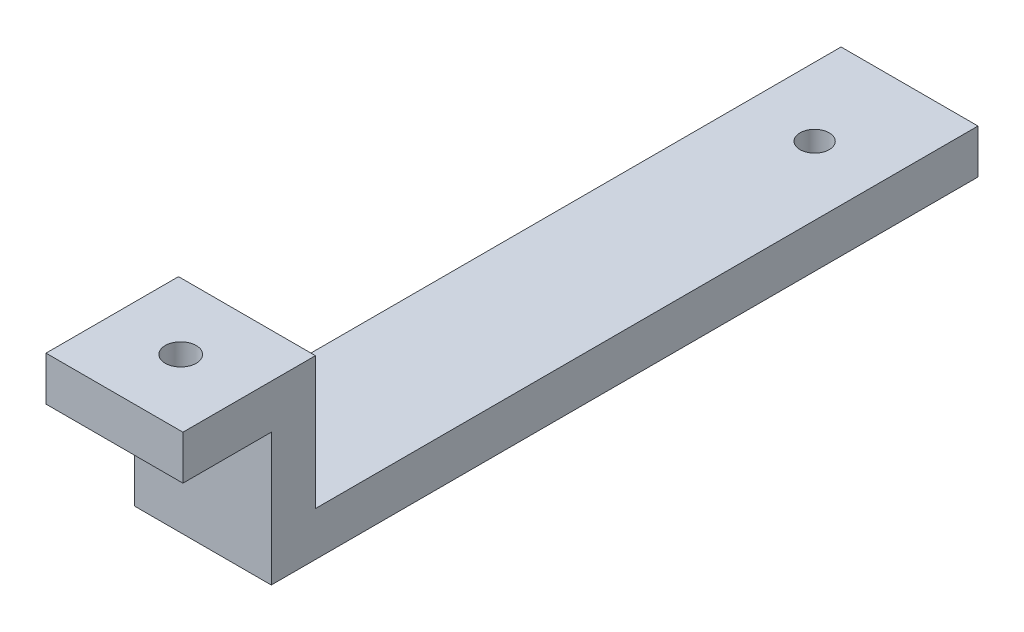
from build123d import *

# Parameters (mm, degrees)
EXTRUDE_THIN1_DEPTH = 31
SKETCH6_R           = 3.5
CUT_EXTRUDE1_DEPTH  = 10
SKETCH7_R           = 3.302
CUT_EXTRUDE3_DEPTH  = 10.16


with BuildPart() as part:
    # Sketch1 → Extrude-Thin1 (new body)
    with BuildSketch(Plane(origin=(0, 0, 0), x_dir=(0, 0, -1), z_dir=(1, 0, 0))):
        Polygon((0, 0), (30, 0), (30, -29.972), (180, -29.972), (180, -39.972), (20, -39.972), (20, -10), (0, -10), align=None)
    extrude(amount=EXTRUDE_THIN1_DEPTH)

    # Sketch6 → Cut-Extrude1 (cut)
    with BuildSketch(Plane(origin=(0, 0, 0), x_dir=(1, 0, 0), z_dir=(0, 1, 0))):
        with Locations((15.5, 15)):
            Circle(SKETCH6_R)
    extrude(amount=-CUT_EXTRUDE1_DEPTH, mode=Mode.SUBTRACT)

    # Sketch7 → Cut-Extrude3 (cut)
    with BuildSketch(Plane(origin=(0, -29.972, 0), x_dir=(1, 0, 0), z_dir=(0, 1, 0))):
        with Locations((15.494, 158.524)):
            Circle(SKETCH7_R)
    extrude(amount=-CUT_EXTRUDE3_DEPTH, mode=Mode.SUBTRACT)


solid = part.part
